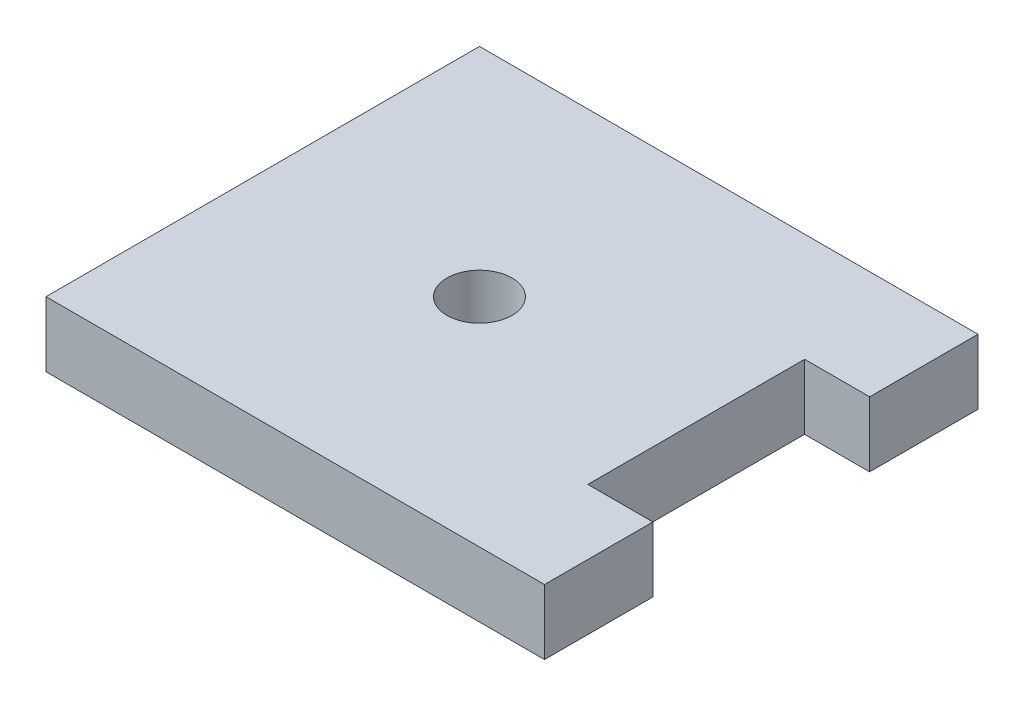
from build123d import *

# Parameters (mm, degrees)
SKETCH1_R           = 1.5
BOSS_EXTRUDE1_DEPTH = 3


with BuildPart() as part:
    # Sketch1 → Boss-Extrude1 (new body)
    with BuildSketch(Plane(origin=(0, 0, 0), x_dir=(1, 0, 0), z_dir=(0, 1, 0))):
        Polygon((0, 0), (20, 0), (23, 0), (23, 5), (20, 5), (20, 15), (23, 15), (23, 20), (20, 20), (0, 20), align=None)
        with Locations((10, 10)):
            Circle(SKETCH1_R, mode=Mode.SUBTRACT)
    extrude(amount=BOSS_EXTRUDE1_DEPTH)


solid = part.part
